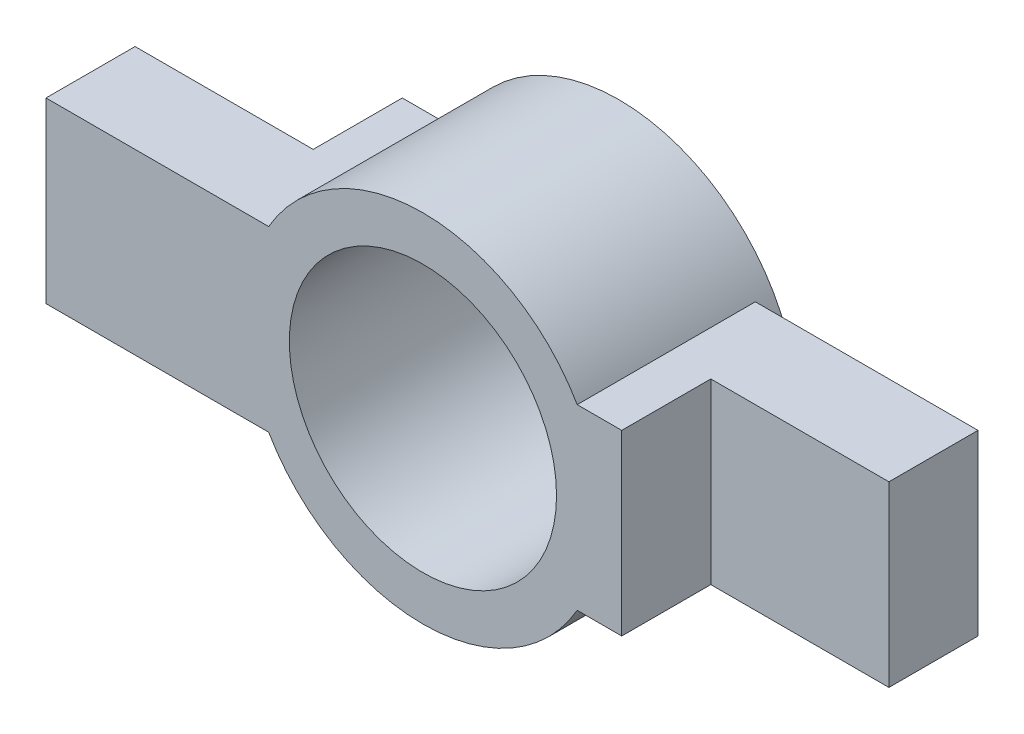
from build123d import *

# Parameters (mm, degrees)
CROQUIS1_R              = 20
SALIENTE_EXTRUIR1_DEPTH = 11
CROQUIS6_R              = 15
CORTAR_EXTRUIR1_DEPTH   = 36.832945734
CROQUIS7_W              = 25
CROQUIS7_H              = 20
SALIENTE_EXTRUIR3_DEPTH = 20
CROQUIS8_W              = 20
CROQUIS8_H              = 20
CORTAR_EXTRUIR2_DEPTH   = 10
CROQUIS9_W              = 20
CROQUIS9_H              = 20
CORTAR_EXTRUIR3_DEPTH   = 10


with BuildPart() as part:
    # Croquis1 → Saliente-Extruir1 (new, symmetric)
    with BuildSketch(Plane.XY):
        Circle(CROQUIS1_R)
    extrude(amount=SALIENTE_EXTRUIR1_DEPTH, both=True)

    # Croquis6 → Cortar-Extruir1 (cut, through all)
    with BuildSketch(Plane.XY.offset(11)):
        Circle(CROQUIS6_R)
    extrude(amount=-CORTAR_EXTRUIR1_DEPTH, mode=Mode.SUBTRACT)

    # Croquis7 → Saliente-Extruir3 (add)
    with BuildSketch(Plane.XY.offset(11)):
        with Locations((-29.820508076, 0)):
            Rectangle(CROQUIS7_W, CROQUIS7_H)
    saliente_extruir3 = extrude(amount=-SALIENTE_EXTRUIR3_DEPTH)

    # Croquis8 → Cortar-Extruir2 (cut)
    with BuildSketch(Plane(origin=(0, 0, -9), x_dir=(-1, 0, 0), z_dir=(0, 0, -1))):
        with Locations((32.320508076, 0)):
            Rectangle(CROQUIS8_W, CROQUIS8_H)
        with Locations((-32.320508076, 0)):
            Rectangle(CROQUIS8_W, CROQUIS8_H)
    extrude(amount=-CORTAR_EXTRUIR2_DEPTH, mode=Mode.SUBTRACT)

    # Simetría1: Saliente-Extruir3 across plane
    add(saliente_extruir3.mirror(Plane(origin=(0, 0, 0), x_dir=(0, 0, 1), z_dir=(1, 0, 0))))

    # Croquis9 → Cortar-Extruir3 (cut)
    with BuildSketch(Plane.XY.offset(11)):
        with Locations((32.320508076, 0)):
            Rectangle(CROQUIS9_W, CROQUIS9_H)
    extrude(amount=-CORTAR_EXTRUIR3_DEPTH, mode=Mode.SUBTRACT)


solid = part.part
